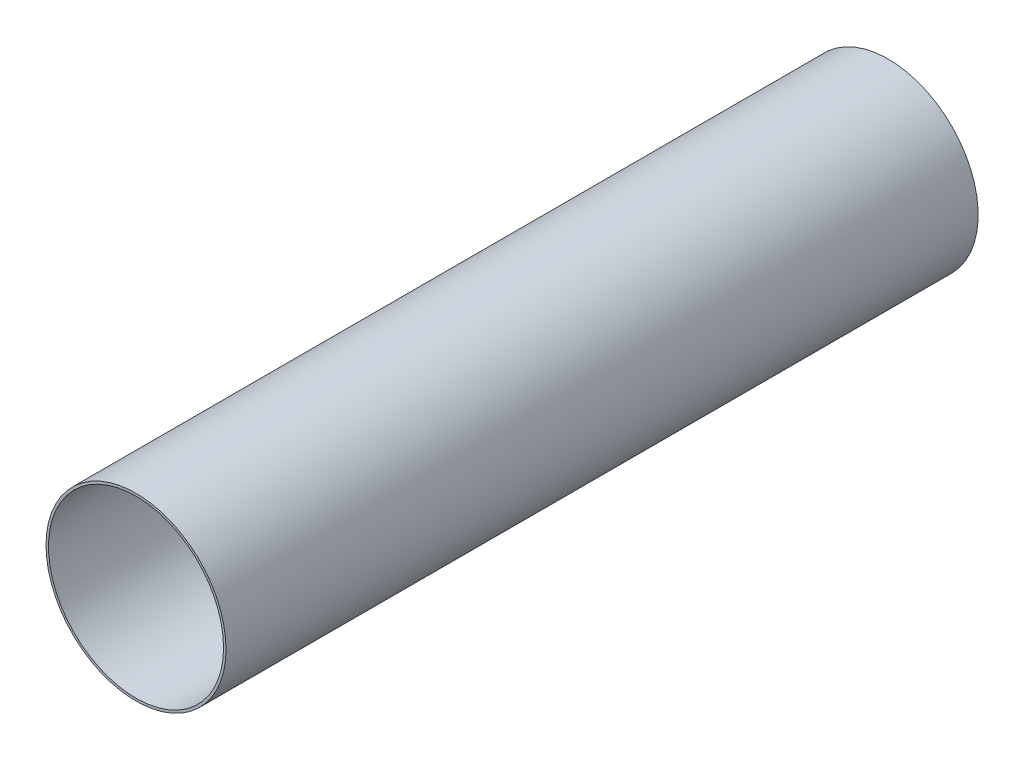
from build123d import *

# Parameters (mm, degrees)
SKETCH1_R           = 73
SKETCH1_R_2         = 71
BOSS_EXTRUDE1_DEPTH = 608
BOSS_EXTRUDE2_START = 2
SKETCH2_R           = 73
BOSS_EXTRUDE2_DEPTH = 2


with BuildPart() as part:
    # Sketch1 → Boss-Extrude1 (new body)
    with BuildSketch(Plane.XY):
        Circle(SKETCH1_R)
        Circle(SKETCH1_R_2, mode=Mode.SUBTRACT)
    extrude(amount=BOSS_EXTRUDE1_DEPTH)

    # Sketch2 → Boss-Extrude2 (add)
    with BuildSketch(Plane(origin=(0, 0, 0), x_dir=(-1, 0, 0), z_dir=(0, 0, -1)).offset(BOSS_EXTRUDE2_START)):
        Circle(SKETCH2_R)
    extrude(amount=-BOSS_EXTRUDE2_DEPTH)


solid = part.part
